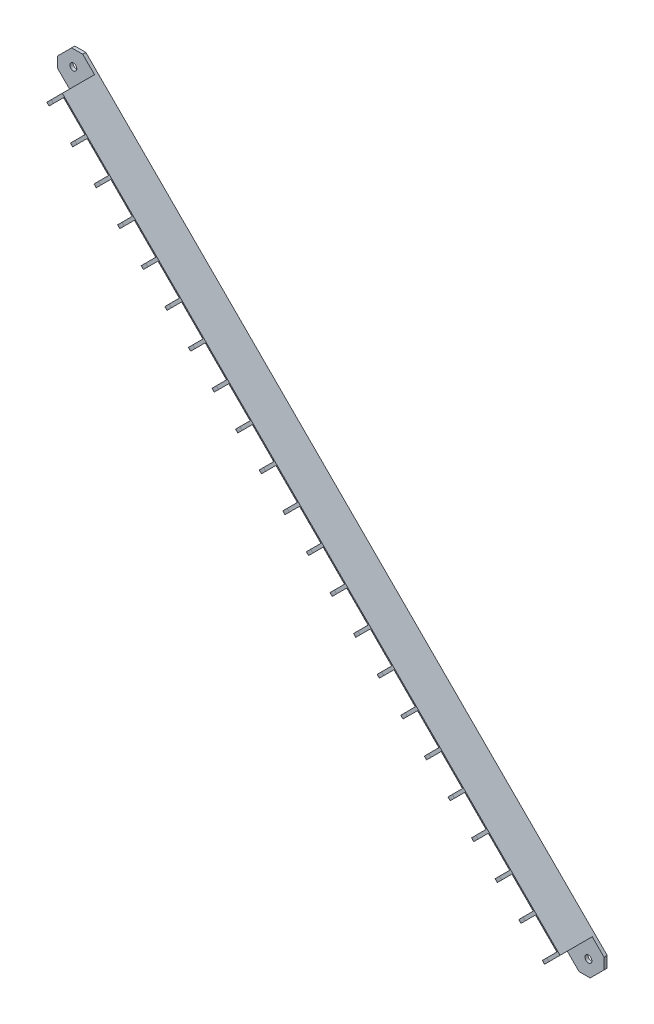
from build123d import *

# Parameters (mm, degrees)
BOSS_EXTRUDE2_DEPTH = 15.4
BOSS_EXTRUDE4_DEPTH = 1.6
LPATTERN1_COUNT     = 21
LPATTERN1_PITCH     = 17
BOSS_EXTRUDE5_START = 1.6
BOSS_EXTRUDE5_DEPTH = 1.6
SKETCH5_R           = 1.75
BOSS_EXTRUDE6_DEPTH = 1.6
CHAMFER1_SIZE       = 4


# Read off the part's stored shape, not the designer's step: Imported1
with BuildPart() as part:
    # Sketch2 → Boss-Extrude2 (new body)
    with BuildSketch(Plane(origin=(-84.711375962, 84.711326374, 0), x_dir=(0, 0, 1), z_dir=(-0.7071069881470023, 0.7071065742260323, 0))):
        with BuildLine():
            Line((17.999999225, 185.776650849), (17.999999225, 185.215701934))
            ThreePointArc((17.999999225, 185.215701934), (17.943392582, 185.010537776), (17.789566889, 184.863451745))
            Line((17.789566889, 184.863451745), (11.840286665, 181.661737422))
            ThreePointArc((11.840286665, 181.661737422), (10.948821205, 181.606515994), (10.368812829, 182.285743759))
            Line((10.368812829, 182.285743759), (9.722721647, 183.478557215))
            Line((9.722721647, 183.478557215), (9.01561146, 184.185660591))
            Line((9.01561146, 184.185660591), (1.590990258, 176.761039388))
            Line((1.590990258, 176.761039388), (2.298093634, 176.053929202))
            Line((2.298093634, 176.053929202), (3.49090709, 175.407838019))
            ThreePointArc((3.49090709, 175.407838019), (4.170134855, 174.827829644), (4.114913426, 173.936364184))
            Line((4.114913426, 173.936364184), (0.913199103, 167.987083959))
            ThreePointArc((0.913199103, 167.987083959), (0.766113073, 167.833258267), (0.560948914, 167.776651623))
            Line((0.560948914, 167.776651623), (0, 167.776651623))
            Line((0, 167.776651623), (0, 185.776650849))
            Line((0, 185.776650849), (17.999999225, 185.776650849))
        make_face()
    extrude(amount=BOSS_EXTRUDE2_DEPTH)

    # Sketch3 → Boss-Extrude4 (add)
    with BuildSketch(Plane(origin=(-84.711375962, 84.711326374, 0), x_dir=(0, 0, 1), z_dir=(-0.7071069881470023, 0.7071065742260323, 0))):
        with BuildLine():
            Line((17.999999225, 185.776650849), (17.999999225, 177.776650849))
            ThreePointArc((17.999999225, 177.776650849), (15.071067538, 170.705583859), (8.000000775, 167.776651623))
            Line((8.000000775, 167.776651623), (0, 167.776651623))
            Line((0, 167.776651623), (0, 185.776650849))
            Line((0, 185.776650849), (17.999999225, 185.776650849))
        make_face()
        with BuildLine():
            Line((7.424621202, 178.352029646), (10.253048327, 181.180456771))
            ThreePointArc((10.253048327, 181.180456771), (10.478608064, 181.715538219), (10.368812829, 182.285743759))
            Line((10.368812829, 182.285743759), (9.722721647, 183.478557215))
            Line((9.722721647, 183.478557215), (9.01561146, 184.185660591))
            Line((9.01561146, 184.185660591), (1.590990258, 176.761039388))
            Line((1.590990258, 176.761039388), (2.298093634, 176.053929202))
            Line((2.298093634, 176.053929202), (3.49090709, 175.407838019))
            ThreePointArc((3.49090709, 175.407838019), (4.06111263, 175.298042785), (4.596194078, 175.523602521))
            Line((4.596194078, 175.523602521), (7.424621202, 178.352029646))
        make_face(mode=Mode.SUBTRACT)
    extrude(amount=-BOSS_EXTRUDE4_DEPTH)


with BuildPart() as lpattern1_1:
    # LPattern1: pattern copy
    add(part.part.moved(Location(Vector(-0.7071069881470021, 0.7071065742260323, 0) * (1 * LPATTERN1_PITCH))))


with BuildPart() as lpattern1_2:
    # LPattern1: pattern copy
    add(part.part.moved(Location(Vector(-0.7071069881470021, 0.7071065742260323, 0) * (2 * LPATTERN1_PITCH))))


with BuildPart() as lpattern1_3:
    # LPattern1: pattern copy
    add(part.part.moved(Location(Vector(-0.7071069881470021, 0.7071065742260323, 0) * (3 * LPATTERN1_PITCH))))


with BuildPart() as lpattern1_4:
    # LPattern1: pattern copy
    add(part.part.moved(Location(Vector(-0.7071069881470021, 0.7071065742260323, 0) * (4 * LPATTERN1_PITCH))))


with BuildPart() as lpattern1_5:
    # LPattern1: pattern copy
    add(part.part.moved(Location(Vector(-0.7071069881470021, 0.7071065742260323, 0) * (5 * LPATTERN1_PITCH))))


with BuildPart() as lpattern1_6:
    # LPattern1: pattern copy
    add(part.part.moved(Location(Vector(-0.7071069881470021, 0.7071065742260323, 0) * (6 * LPATTERN1_PITCH))))


with BuildPart() as lpattern1_7:
    # LPattern1: pattern copy
    add(part.part.moved(Location(Vector(-0.7071069881470021, 0.7071065742260323, 0) * (7 * LPATTERN1_PITCH))))


with BuildPart() as lpattern1_8:
    # LPattern1: pattern copy
    add(part.part.moved(Location(Vector(-0.7071069881470021, 0.7071065742260323, 0) * (8 * LPATTERN1_PITCH))))


with BuildPart() as lpattern1_9:
    # LPattern1: pattern copy
    add(part.part.moved(Location(Vector(-0.7071069881470021, 0.7071065742260323, 0) * (9 * LPATTERN1_PITCH))))


with BuildPart() as lpattern1_10:
    # LPattern1: pattern copy
    add(part.part.moved(Location(Vector(-0.7071069881470021, 0.7071065742260323, 0) * (10 * LPATTERN1_PITCH))))


with BuildPart() as lpattern1_11:
    # LPattern1: pattern copy
    add(part.part.moved(Location(Vector(-0.7071069881470021, 0.7071065742260323, 0) * (11 * LPATTERN1_PITCH))))


with BuildPart() as lpattern1_12:
    # LPattern1: pattern copy
    add(part.part.moved(Location(Vector(-0.7071069881470021, 0.7071065742260323, 0) * (12 * LPATTERN1_PITCH))))


with BuildPart() as lpattern1_13:
    # LPattern1: pattern copy
    add(part.part.moved(Location(Vector(-0.7071069881470021, 0.7071065742260323, 0) * (13 * LPATTERN1_PITCH))))


with BuildPart() as lpattern1_14:
    # LPattern1: pattern copy
    add(part.part.moved(Location(Vector(-0.7071069881470021, 0.7071065742260323, 0) * (14 * LPATTERN1_PITCH))))


with BuildPart() as lpattern1_15:
    # LPattern1: pattern copy
    add(part.part.moved(Location(Vector(-0.7071069881470021, 0.7071065742260323, 0) * (15 * LPATTERN1_PITCH))))


with BuildPart() as lpattern1_16:
    # LPattern1: pattern copy
    add(part.part.moved(Location(Vector(-0.7071069881470021, 0.7071065742260323, 0) * (16 * LPATTERN1_PITCH))))


with BuildPart() as lpattern1_17:
    # LPattern1: pattern copy
    add(part.part.moved(Location(Vector(-0.7071069881470021, 0.7071065742260323, 0) * (17 * LPATTERN1_PITCH))))


with BuildPart() as lpattern1_18:
    # LPattern1: pattern copy
    add(part.part.moved(Location(Vector(-0.7071069881470021, 0.7071065742260323, 0) * (18 * LPATTERN1_PITCH))))


with BuildPart() as lpattern1_19:
    # LPattern1: pattern copy
    add(part.part.moved(Location(Vector(-0.7071069881470021, 0.7071065742260323, 0) * (19 * LPATTERN1_PITCH))))


with BuildPart() as lpattern1_20:
    # LPattern1: pattern copy
    add(part.part.moved(Location(Vector(-0.7071069881470021, 0.7071065742260323, 0) * (20 * LPATTERN1_PITCH))))


with BuildPart() as body_22:
    # Sketch4 → Boss-Extrude5 (new body)
    with BuildSketch(Plane(origin=(-336.017199549, 336.017002854, 0), x_dir=(0, 0, 1), z_dir=(-0.7071069881470021, 0.7071065742260323, 0)).offset(BOSS_EXTRUDE5_START)):
        with BuildLine():
            Line((17.999999225, 177.776650849), (17.999999225, 185.776650849))
            Line((17.999999225, 185.776650849), (0, 185.776650849))
            Line((0, 185.776650849), (0, 167.776651623))
            Line((0, 167.776651623), (8.000000775, 167.776651623))
            ThreePointArc((8.000000775, 167.776651623), (15.071067538, 170.705583859), (17.999999225, 177.776650849))
        make_face()
        with BuildLine():
            Line((2.298093634, 176.053929202), (3.49090709, 175.407838019))
            ThreePointArc((3.49090709, 175.407838019), (4.06111263, 175.298042785), (4.596194078, 175.523602521))
            Line((4.596194078, 175.523602521), (7.424621202, 178.352029646))
            Line((7.424621202, 178.352029646), (10.253048327, 181.180456771))
            ThreePointArc((10.253048327, 181.180456771), (10.478608064, 181.715538219), (10.368812829, 182.285743759))
            Line((10.368812829, 182.285743759), (9.722721647, 183.478557215))
            Line((9.722721647, 183.478557215), (9.01561146, 184.185660591))
            Line((9.01561146, 184.185660591), (1.590990258, 176.761039388))
            Line((1.590990258, 176.761039388), (2.298093634, 176.053929202))
        make_face(mode=Mode.SUBTRACT)
    extrude(amount=-BOSS_EXTRUDE5_DEPTH)


with BuildPart() as lpattern1_1_1:
    add(lpattern1_1.part)

    # Combine1: union LPattern1_18, LPattern1_11, LPattern1_4, LPattern1_14, LPattern1_7, LPattern1_10, LPattern1_3, LPattern1_20, LPattern1_13, part, LPattern1_6, body 22, LPattern1_9, LPattern1_2, LPattern1_19, LPattern1_12, LPattern1_5, LPattern1_15, LPattern1_8, LPattern1_16, LPattern1_17
    add(lpattern1_18.part)
    add(lpattern1_11.part)
    add(lpattern1_4.part)
    add(lpattern1_14.part)
    add(lpattern1_7.part)
    add(lpattern1_10.part)
    add(lpattern1_3.part)
    add(lpattern1_20.part)
    add(lpattern1_13.part)
    add(part.part)
    add(lpattern1_6.part)
    add(body_22.part)
    add(lpattern1_9.part)
    add(lpattern1_2.part)
    add(lpattern1_19.part)
    add(lpattern1_12.part)
    add(lpattern1_5.part)
    add(lpattern1_15.part)
    add(lpattern1_8.part)
    add(lpattern1_16.part)
    add(lpattern1_17.part)

    # Sketch5 → Boss-Extrude6 (add)
    # profile 1 of 2: a face of its own
    with BuildSketch(Plane(origin=(0, 0, 0), x_dir=(-1, 0, 0), z_dir=(0, 0, -1))):
        Polygon((218.512597365, 455.784416183), (227.351434717, 464.623248361), (214.623516929, 477.3511736), (205.784679577, 468.512341422), align=None)
        with Locations(Location((216.573576767, 466.562275268, 0), (0, 0, 90))):
            Circle(SKETCH5_R, mode=Mode.SUBTRACT)
    # profile 2 of 2: a face of its own
    with BuildSketch(Plane(origin=(0, 0, 0), x_dir=(-1, 0, 0), z_dir=(0, 0, -1))):
        Polygon((-35.055968584, 202.215998666), (-47.783886372, 214.943923905), (-56.622723724, 206.105091727), (-43.894805936, 193.377166488), align=None)
        with Locations(Location((-45.833826534, 204.155025573, 0), (0, 0, 270))):
            Circle(SKETCH5_R, mode=Mode.SUBTRACT)
    extrude(amount=-BOSS_EXTRUDE6_DEPTH)

    # Chamfer1
    chamfer1_edges = [lpattern1_1_1.edges().sort_by_distance(p)[0] for p in [
        (-214.623516929, 477.3511736, 0.8),
        (-227.351434717, 464.623248361, 0.8),
        (43.894805936, 193.377166488, 0.8),
        (56.622723724, 206.105091727, 0.8),
    ]]
    chamfer(chamfer1_edges, length=CHAMFER1_SIZE)


solid = lpattern1_1_1.part
